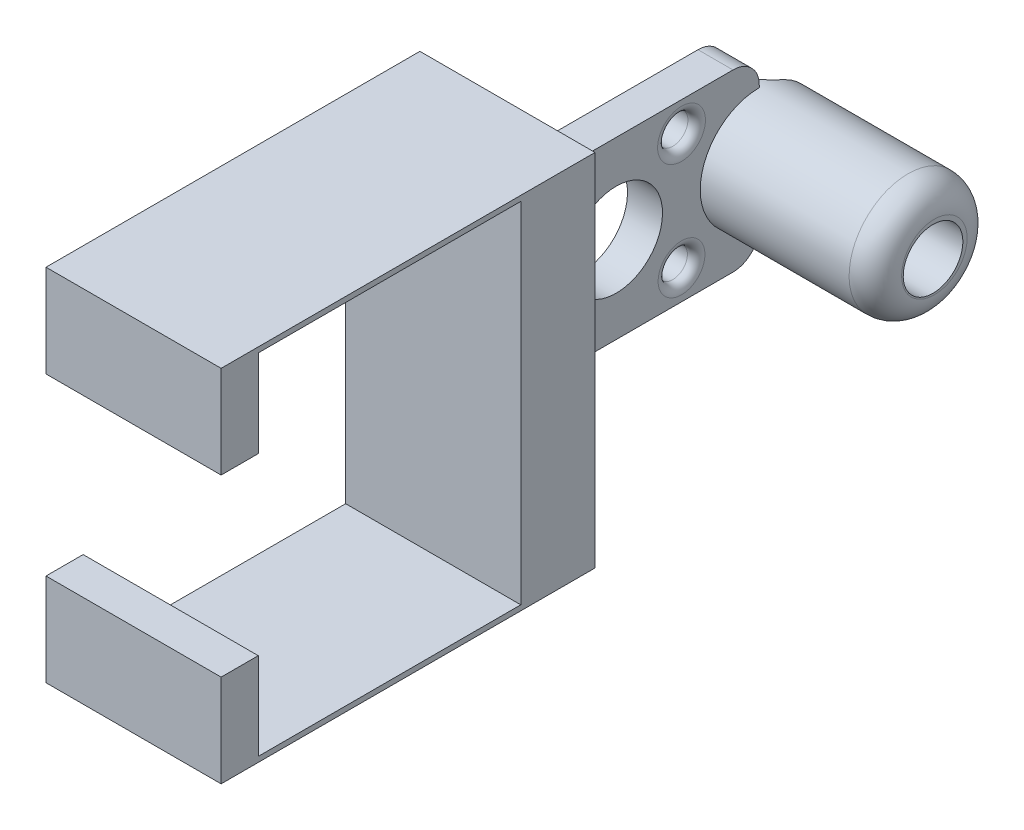
from build123d import *

# Parameters (mm, degrees)
BOSS_EXTRUDE1_DEPTH = 25.4
SKETCH3_W           = 5.08
SKETCH3_H           = 25.4
BOSS_EXTRUDE2_DEPTH = 38.1
SKETCH5_R           = 8.5598
BOSS_EXTRUDE3_DEPTH = 25.4
SKETCH6_R           = 6.720119977
CUT_EXTRUDE1_DEPTH  = 88.97495844
FILLET1_R           = 3.81
FILLET2_R           = 3.81
SKETCH7_R           = 4.32452928
CUT_EXTRUDE2_DEPTH  = 12.7
FILLET3_R           = 3.81
SKETCH8_R           = 2.122443339
SKETCH8_R_2         = 2.197328391
SKETCH8_R_3         = 2.338050865
SKETCH8_R_4         = 2.057073387
CUT_EXTRUDE3_DEPTH  = 88.974958469
FILLET4_R           = 3.81
FILLET5_R           = 1.27


with BuildPart() as part:
    # Sketch1 → Boss-Extrude1 (new body)
    with BuildSketch(Plane.YZ):
        Polygon((11.336319652, 55.298739647), (24.747519652, 55.298739647), (24.747519652, 49.913939647), (12.098319652, 49.913939647), (12.098319652, 11.839339647), (62.771319652, 11.839339647), (62.771319652, 49.913939647), (50.122119652, 49.913939647), (50.122119652, 55.298739647), (63.533319652, 55.298739647), (63.533319652, 1.069739647), (11.336319652, 1.069739647), align=None)
    extrude(amount=BOSS_EXTRUDE1_DEPTH)

    # Sketch3 → Boss-Extrude2 (add)
    with BuildSketch(Plane(origin=(0, 0, 1.069739647), x_dir=(1, 0, 0), z_dir=(0, 0, -1))):
        with Locations((8.5807342, -36.91322057)):
            Rectangle(SKETCH3_W, SKETCH3_H)
    extrude(amount=BOSS_EXTRUDE2_DEPTH)

    # Sketch5 → Boss-Extrude3 (add)
    with BuildSketch(Plane.YZ.offset(11.1207342)):
        with Locations((36.91322057, -37.030260353)):
            Circle(SKETCH5_R)
    extrude(amount=BOSS_EXTRUDE3_DEPTH)

    # Sketch6 → Cut-Extrude1 (cut, through all)
    with BuildSketch(Plane.YZ.offset(11.1207342)):
        with Locations((36.75998496, -16.276406843)):
            Circle(SKETCH6_R)
    extrude(amount=-CUT_EXTRUDE1_DEPTH, mode=Mode.SUBTRACT)

    # Fillet1
    # the kernel refuses this fillet: 3.81 mm, written as the material it adds along each edge
    with BuildSketch(Plane(origin=(11.1207342, 18.82842057, -37.030260353), x_dir=(-1, 0, 0), z_dir=(0, 1, 0))) as fillet1_piece_1_section:
        with BuildLine():
            CenterArc((FILLET1_R, -FILLET1_R), FILLET1_R, 90, 90)
            Line((0, -FILLET1_R), (0, 0))
            Line((0, 0), (FILLET1_R, 0))
        make_face()
    fillet1_piece_1 = extrude(amount=36.1696, mode=Mode.PRIVATE)
    fillet1_piece_1 = fillet1_piece_1 & Plane(origin=(10.265201689, 36.91322057, -37.030260353), x_dir=(0, 1, 0), z_dir=(-1, 0, 0)) * Cylinder(8.5598, 88, mode=Mode.PRIVATE)
    add(fillet1_piece_1)

    # Fillet2
    fillet2_edges = [part.edges().sort_by_distance(p)[0] for p in [
        (6.0407342, 36.91322057, 1.069739647),
        (8.5807342, 49.61322057, 1.069739647),
        (11.1207342, 36.91322057, 1.069739647),
        (8.5807342, 24.21322057, 1.069739647),
    ]]
    fillet(fillet2_edges, radius=FILLET2_R)

    # Sketch7 → Cut-Extrude2 (cut, symmetric)
    with BuildSketch(Plane.YZ.offset(36.5207342)):
        with Locations((36.778432594, -36.832854178)):
            Circle(SKETCH7_R)
    extrude(amount=CUT_EXTRUDE2_DEPTH, both=True, mode=Mode.SUBTRACT)

    # Fillet3
    fillet3_edges = [part.edges().sort_by_distance(p)[0] for p in [
        (23.8207342, 32.453903314, -36.832854178),
    ]]
    fillet(fillet3_edges, radius=FILLET3_R)

    # Sketch8 → Cut-Extrude3 (cut, through all)
    with BuildSketch(Plane.YZ.offset(11.1207342)):
        with Locations((28.491090994, -25.75522287)):
            Circle(SKETCH8_R)
        with Locations((45.321691436, -25.75522287)):
            Circle(SKETCH8_R_2)
        with Locations((45.321691436, -6.400032362)):
            Circle(SKETCH8_R_3)
        with Locations((28.491090994, -6.400032362)):
            Circle(SKETCH8_R_4)
    extrude(amount=-CUT_EXTRUDE3_DEPTH, mode=Mode.SUBTRACT)

    # Fillet4
    fillet4_edges = [part.edges().sort_by_distance(p)[0] for p in [
        (8.5807342, 49.61322057, -37.030260353),
        (8.5807342, 24.21322057, -37.030260353),
        (36.5207342, 28.35342057, -37.030260353),
    ]]
    fillet(fillet4_edges, radius=FILLET4_R)

    # Fillet5
    fillet5_edges = [part.edges().sort_by_distance(p)[0] for p in [
        (6.0407342, 26.434017606, -6.400032362),
        (11.1207342, 26.434017606, -6.400032362),
        (6.0407342, 42.983640571, -6.400032362),
        (11.1207342, 42.983640571, -6.400032362),
        (6.0407342, 43.124363045, -25.75522287),
        (11.1207342, 43.124363045, -25.75522287),
        (6.0407342, 26.368647655, -25.75522287),
        (11.1207342, 26.368647655, -25.75522287),
    ]]
    fillet(fillet5_edges, radius=FILLET5_R)


solid = part.part
